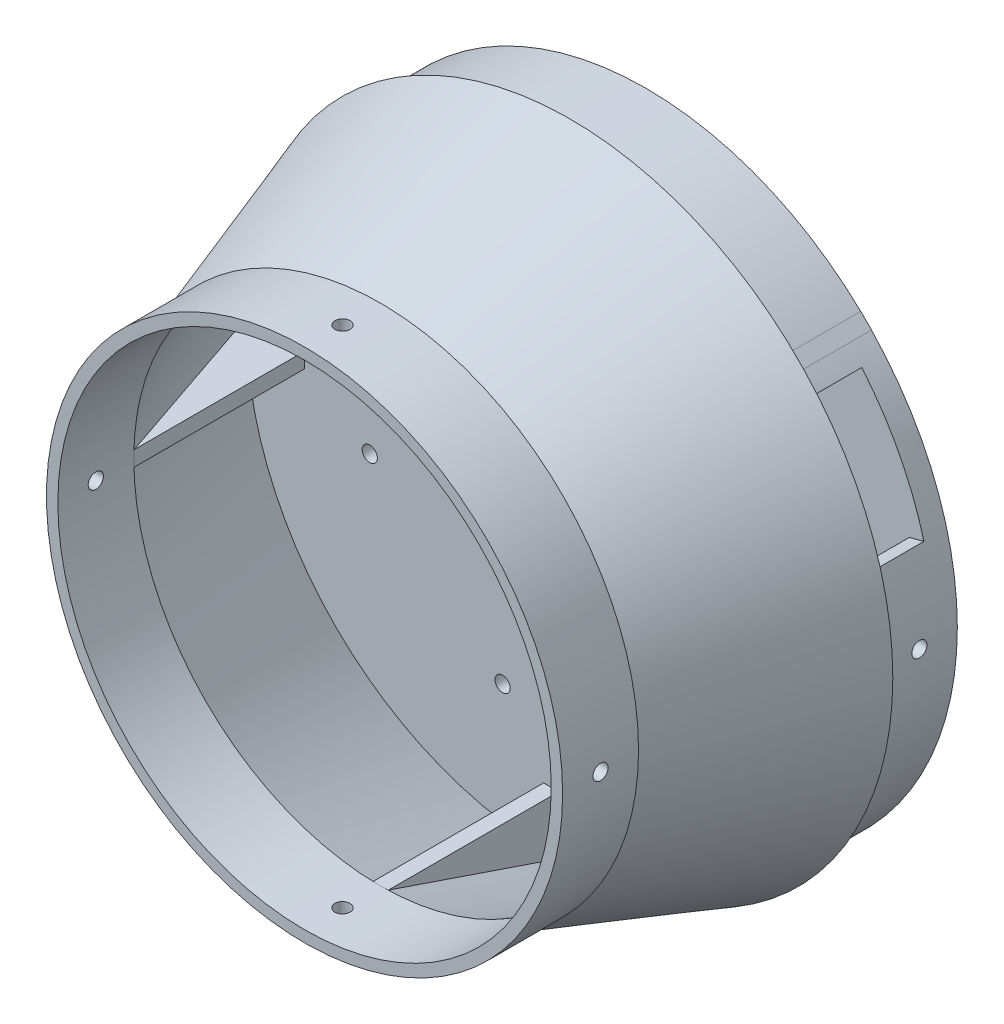
from build123d import *

# Parameters (mm, degrees)
BOSS_EXTRUDE5_DEPTH             = 2
CIRPATTERN3_COUNT               = 4
BOSS_EXTRUDE6_DEPTH             = 20
SKETCH14_R                      = 2
CUT_EXTRUDE1_DEPTH              = 95.00000000000004
CIRPATTERN4_COUNT               = 4
FILLET1_R                       = 5
SKETCH16_R                      = 2.000000000000001
CUT_EXTRUDE2_DEPTH              = 94.00000000000004
CIRPATTERN5_COUNT               = 2
CIRPATTERN5_ANGLE               = 90.0000000000002
CIRPATTERN5_THE_OTHER_WAY_COUNT = 2
CIRPATTERN5_THE_OTHER_WAY_ANGLE = 90.0000000000002
SKETCH17_R                      = 2.0000000000000018
SKETCH17_R_2                    = 1.9999999999984424
SKETCH17_R_3                    = 1.9999999999962943
SKETCH17_R_4                    = 1.9999999999898757
CUT_EXTRUDE4_DEPTH              = 900
CUT_EXTRUDE7_START              = -20
CUT_EXTRUDE7_DEPTH              = 20
BOSS_EXTRUDE8_START             = -6
SKETCH22_R                      = 81.99999999999999
SKETCH22_R_2                    = 60
BOSS_EXTRUDE8_DEPTH             = 6
SKETCH24_R                      = 25
CUT_EXTRUDE8_DEPTH              = 5
SKETCH28_W                      = 13.999999999999986
SKETCH28_H                      = 19.999999999999986
BOSS_EXTRUDE9_DEPTH             = 2
CIRPATTERN6_COUNT               = 4


with BuildPart() as part:
    # Sketch10 → Revolve2 (revolve)
    with BuildSketch(Plane(origin=(0, 0, 0), x_dir=(1, 0, 0), z_dir=(0, 1, 0))):
        Polygon((68, 0), (84.99999999999999, 50.000000000000014), (0, 50), (6.1e-16, 44.99999999999999), (80.29999999999998, 44.999999999999986), (65, -5.63e-15), (65, -20), (68, -20), align=None)
    revolve(axis=Axis((0, 0, 0), (0, 0, -1)))

    # Sketch12 → Boss-Extrude5 (add, symmetric)
    with BuildSketch(Plane(origin=(0, 0, 0), x_dir=(1, 0, 0), z_dir=(0, 1, 0))):
        Polygon((-80.29999999999998, 44.999999999999986), (-65, -6.94e-15), (-65, 44.999999999999986), align=None)
    boss_extrude5 = extrude(amount=BOSS_EXTRUDE5_DEPTH, both=True)

    # CirPattern3: Boss-Extrude5 ×4 about axis
    cirpattern3_axis = Axis((0, 0, -50.000000000000014), (0, 0, 1))
    for i in range(1, CIRPATTERN3_COUNT):
        add(boss_extrude5.rotate(cirpattern3_axis, i * 360 / CIRPATTERN3_COUNT))

    # Sketch13 → Boss-Extrude6 (add)
    with BuildSketch(Plane(origin=(0, 0, -50.00000000000001), x_dir=(-1, 0, 0), z_dir=(0, 0, -1))):
        with BuildLine():
            ThreePointArc((81.99999999999999, 0), (78.94301742396219, 22.181073012818818), (70, 42.70831300812521))
            ThreePointArc((70.00000000000001, 42.70831300812522), (-82, -3.73e-14), (70.00000000000003, -42.70831300812524))
            ThreePointArc((70, -42.70831300812522), (78.94301742396219, -22.18107301281883), (81.99999999999999, -2.008e-14))
        make_face()
        with BuildLine():
            ThreePointArc((70.00000000000001, -34.40930106817047), (-77.99999999999999, -3.02e-14), (70, 34.40930106817045))
            ThreePointArc((70.00000000000001, 34.40930106817046), (75.97367965289031, 17.663521732655667), (78, 0))
            ThreePointArc((78, -1.91e-14), (75.97367965289031, -17.663521732655717), (70.00000000000001, -34.40930106817047))
        make_face(mode=Mode.SUBTRACT)
    extrude(amount=BOSS_EXTRUDE6_DEPTH)

    # Sketch14 → Cut-Extrude1 (cut)
    with BuildSketch(Plane(origin=(0, 0, 0), x_dir=(1, 0, 0), z_dir=(0, 1, 0))):
        with Locations((0, -10)):
            Circle(SKETCH14_R)
    cut_extrude1 = extrude(amount=-CUT_EXTRUDE1_DEPTH, mode=Mode.SUBTRACT)

    # CirPattern4: Cut-Extrude1 ×4 about axis
    cirpattern4_axis = Axis((0, 0, 20), (0, 0, 1))
    for i in range(1, CIRPATTERN4_COUNT):
        add(cut_extrude1.rotate(cirpattern4_axis, i * 360 / CIRPATTERN4_COUNT), mode=Mode.SUBTRACT)

    # Fillet1
    fillet1_edges = [part.edges().sort_by_distance(p)[0] for p in [
        (70.00000000000136, -34.40930106817083, -50.00000000000001),
    ]]
    fillet(fillet1_edges, radius=FILLET1_R)

    # Sketch16 → Cut-Extrude2 (cut)
    with BuildSketch(Plane(origin=(0, 0, 0), x_dir=(1, 0, 0), z_dir=(0, 1, 0))):
        with Locations((0, 60.00000000000002)):
            Circle(SKETCH16_R)
    cut_extrude2 = extrude(amount=-CUT_EXTRUDE2_DEPTH, mode=Mode.SUBTRACT)

    # CirPattern5: Cut-Extrude2 ×2 about axis
    cirpattern5_axis = Axis((0, 0, -70), (0, 0, -1))
    for i in range(1, CIRPATTERN5_COUNT):
        add(cut_extrude2.rotate(cirpattern5_axis, i * CIRPATTERN5_ANGLE / (CIRPATTERN5_COUNT - 1)), mode=Mode.SUBTRACT)

    # CirPattern5 the other way: Cut-Extrude2 ×2 about axis
    cirpattern5_the_other_way_axis = Axis((0, 0, -70), (0, 0, 1))
    for i in range(1, CIRPATTERN5_THE_OTHER_WAY_COUNT):
        add(cut_extrude2.rotate(cirpattern5_the_other_way_axis, i * CIRPATTERN5_THE_OTHER_WAY_ANGLE / (CIRPATTERN5_THE_OTHER_WAY_COUNT - 1)), mode=Mode.SUBTRACT)

    # Sketch17 → Cut-Extrude4 (cut)
    with BuildSketch(Plane(origin=(0, 0, -50.00000000000001), x_dir=(-1, 0, 0), z_dir=(0, 0, -1))):
        with Locations((-47.81332840130892, 12.811542732574635)):
            Circle(SKETCH17_R)
        with Locations((-12.811542732574251, 47.813328401310926)):
            Circle(SKETCH17_R_2)
        with Locations((12.811542732575758, -47.81332840131803)):
            Circle(SKETCH17_R_3)
        with Locations((47.81332840131364, -12.811542732584947)):
            Circle(SKETCH17_R_4)
    extrude(amount=-CUT_EXTRUDE4_DEPTH, mode=Mode.SUBTRACT)

    # Sketch19 → Cut-Extrude7 (cut)
    with BuildSketch(Plane(origin=(0, 0, -70), x_dir=(-1, 0, 0), z_dir=(0, 0, -1)).offset(CUT_EXTRUDE7_START)):
        with BuildLine():
            Line((0, 0), (-79.20591775570364, 21.223161698406447))
            ThreePointArc((-79.20591775570364, 21.223161698406447), (-72.73488832061426, 37.86338628527262), (-62.81564433575629, 52.70858399429611))
            Line((-62.81564433575629, 52.70858399429611), (0, 0))
        make_face()
    cut_extrude7 = extrude(amount=CUT_EXTRUDE7_DEPTH, mode=Mode.SUBTRACT)

    # Mirror1: Cut-Extrude7 across plane
    add(cut_extrude7.mirror(Plane(origin=(0, 0, 0), x_dir=(0, 0, 1), z_dir=(1, 0, 0))), mode=Mode.SUBTRACT)

    # Sketch22 → Boss-Extrude8 (add)
    with BuildSketch(Plane(origin=(0, 0, -70), x_dir=(-1, 0, 0), z_dir=(0, 0, -1)).offset(BOSS_EXTRUDE8_START)):
        Circle(SKETCH22_R)
        Circle(SKETCH22_R_2, mode=Mode.SUBTRACT)
    extrude(amount=BOSS_EXTRUDE8_DEPTH)

    # Sketch24 → Cut-Extrude8 (cut)
    with BuildSketch(Plane(origin=(0, 0, -50.00000000000001), x_dir=(-1, 0, 0), z_dir=(0, 0, -1))):
        Circle(SKETCH24_R)
    extrude(amount=-CUT_EXTRUDE8_DEPTH, mode=Mode.SUBTRACT)

    # Sketch28 → Boss-Extrude9 (add, symmetric)
    with BuildSketch(Plane(origin=(0, 0, 0), x_dir=(0.7071067811865477, 0.7071067811865475, 0), z_dir=(-0.7071067811865475, 0.7071067811865477, 0))):
        with Locations((-75, 60.00000000000001)):
            Rectangle(SKETCH28_W, SKETCH28_H)
    boss_extrude9 = extrude(amount=BOSS_EXTRUDE9_DEPTH, both=True)

    # CirPattern6: Boss-Extrude9 ×4 about axis
    cirpattern6_axis = Axis((0, 0, -70), (0, 0, -1))
    for i in range(1, CIRPATTERN6_COUNT):
        add(boss_extrude9.rotate(cirpattern6_axis, i * 360 / CIRPATTERN6_COUNT))


solid = part.part
